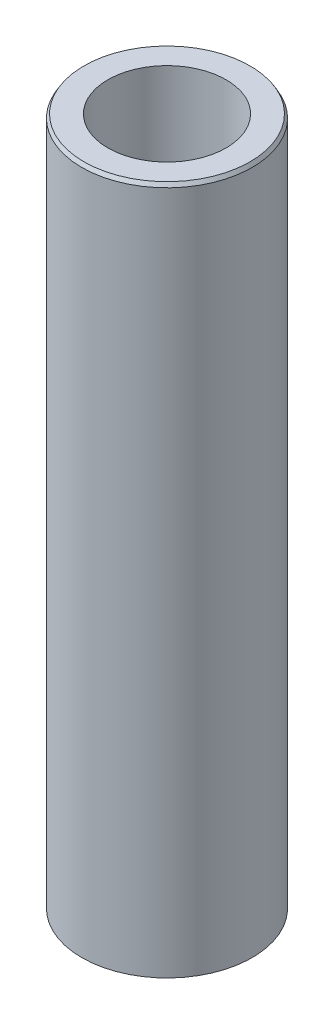
from build123d import *
from OCP.BRepFilletAPI import BRepFilletAPI_MakeChamfer

# Parameters (mm, degrees)
SKETCH1_R           = 52.5
BOSS_EXTRUDE1_DEPTH = 424.988365481
SKETCH2_R           = 36.399814854
CUT_EXTRUDE1_DEPTH  = 432.425092912
CHAMFER1_SIZE       = 2.324853317
CHAMFER1_SIZE2      = 1.342254688


with BuildPart() as part:
    # Sketch1 → Boss-Extrude1 (new body)
    with BuildSketch(Plane(origin=(0, 0, 0), x_dir=(1, 0, 0), z_dir=(0, 1, 0))):
        Circle(SKETCH1_R)
    extrude(amount=BOSS_EXTRUDE1_DEPTH)

    # Sketch2 → Cut-Extrude1 (cut, through all)
    with BuildSketch(Plane(origin=(0, 0, 0), x_dir=(1, 0, 0), z_dir=(0, 1, 0))):
        Circle(SKETCH2_R)
    extrude(amount=CUT_EXTRUDE1_DEPTH, mode=Mode.SUBTRACT)

    # Chamfer1: one chamfer whose edges measure the first distance from different faces: ONE call of the kernel's chamfer builder (chamfer() names one face for all edges)
    chamfer1_edges_1 = [part.edges().sort_by_distance(p)[0] for p in [
        (-52.5, 424.988365481, 0),
    ]]
    chamfer1_side_1 = [part.faces().sort_by_distance(p)[0] for p in [
        (-52.5, 212.49418274, 0),
    ]]
    chamfer1_edges_2 = [part.edges().sort_by_distance(p)[0] for p in [
        (-52.5, 0, 0),
    ]]
    chamfer1_side_2 = [part.faces().sort_by_distance(p)[0] for p in [
        (-51.01507576, 0, 0),
    ]]
    chamfer1 = BRepFilletAPI_MakeChamfer(part.part.solid().wrapped)
    for e in chamfer1_edges_1:
        chamfer1.Add(CHAMFER1_SIZE, CHAMFER1_SIZE2, e.wrapped, chamfer1_side_1[0].wrapped)  # the first distance lies on this face
    for e in chamfer1_edges_2:
        chamfer1.Add(CHAMFER1_SIZE, CHAMFER1_SIZE2, e.wrapped, chamfer1_side_2[0].wrapped)  # the first distance lies on this face
    add(Compound.cast(chamfer1.Shape()), mode=Mode.REPLACE)


solid = part.part
